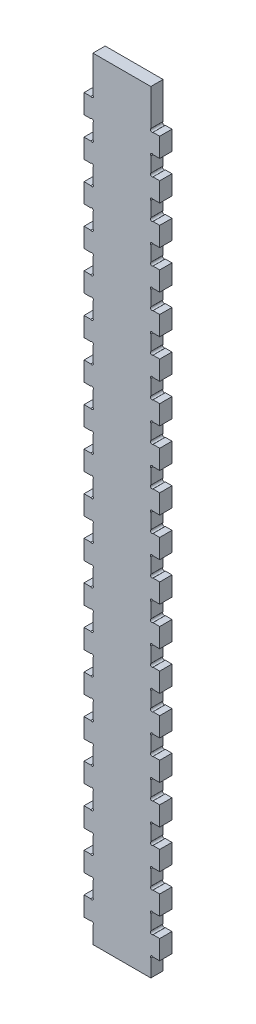
from build123d import *

# Parameters (mm, degrees)
SKETCH1_W           = 29.9974
SKETCH1_H           = 400
BOSS_EXTRUDE1_DEPTH = 6.35
SKETCH2_W           = 4.6
SKETCH2_H           = 10
BOSS_EXTRUDE2_DEPTH = 6.35
LPATTERN1_COUNT     = 19
LPATTERN1_PITCH     = 20
DOGBONE01_D         = 1.5875
DOGBONE02_D         = 1.5875
LPATTERN2_COUNT     = 19
LPATTERN2_PITCH     = 20
LPATTERN4_COUNT     = 19
LPATTERN4_PITCH     = 20


with BuildPart() as part:
    # Sketch1 → Boss-Extrude1 (new body)
    with BuildSketch(Plane.XY):
        Rectangle(SKETCH1_W, SKETCH1_H)
    extrude(amount=BOSS_EXTRUDE1_DEPTH)

    # Sketch2 → Boss-Extrude2 (add)
    with BuildSketch(Plane.XY):
        with Locations((-17.2987, -185)):
            Rectangle(SKETCH2_W, SKETCH2_H)
        with Locations((17.2987, -185)):
            Rectangle(SKETCH2_W, SKETCH2_H)
    boss_extrude2 = extrude(amount=BOSS_EXTRUDE2_DEPTH)

    # LPattern1: Boss-Extrude2 ×19
    with Locations(*[(0, i * LPATTERN1_PITCH, 0) for i in range(1, LPATTERN1_COUNT)]):
        add(boss_extrude2)

    # dogBone01 (through all)
    with Locations(Plane.XY.offset(6.35)):
        with Locations((15.559966008, -190.561266008), (-15.559966008, -190.561266008)):
            dogbone01 = Hole(DOGBONE01_D / 2)

    # dogBone02 (through all)
    with Locations(Plane.XY.offset(6.35)):
        with Locations((15.559966008, -179.438733992), (-15.559966008, -179.438733992)):
            dogbone02 = Hole(DOGBONE02_D / 2)

    # LPattern2: dogBone01 ×19
    with Locations(*[(0, i * LPATTERN2_PITCH, 0) for i in range(1, LPATTERN2_COUNT)]):
        add(dogbone01, mode=Mode.SUBTRACT)

    # LPattern4: dogBone02 ×19
    with Locations(*[(0, i * LPATTERN4_PITCH, 0) for i in range(1, LPATTERN4_COUNT)]):
        add(dogbone02, mode=Mode.SUBTRACT)


solid = part.part
